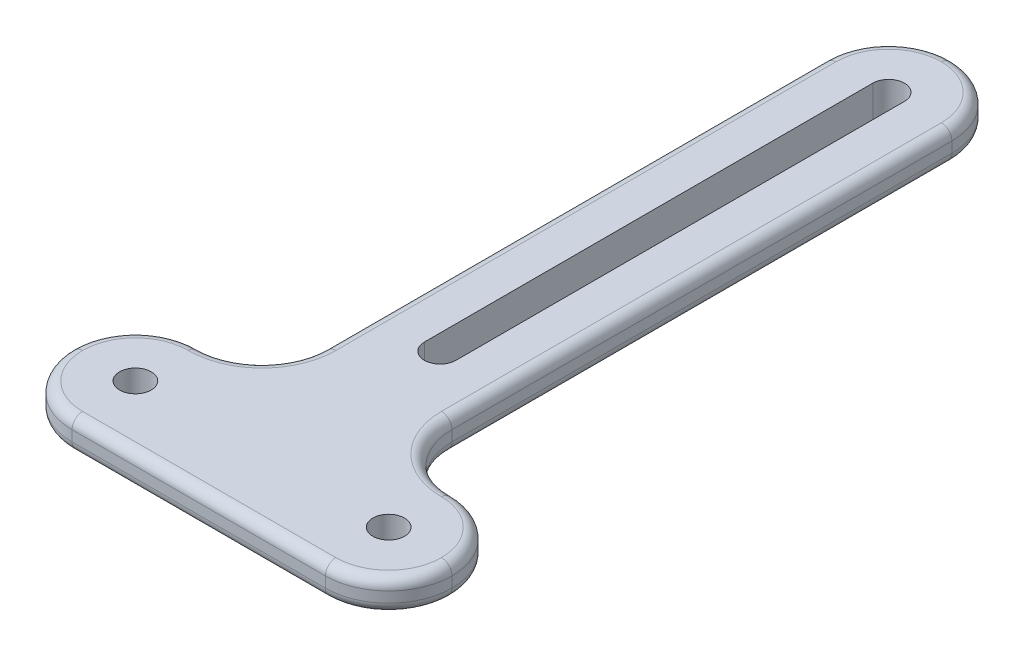
from build123d import *

# Parameters (mm, degrees)
SKETCH1_R           = 3.175
BOSS_EXTRUDE1_DEPTH = 6.35
FILLET2_R           = 12.7
FILLET3_R           = 2.116666667


with BuildPart() as part:
    # Sketch1 → Boss-Extrude1 (new body)
    with BuildSketch(Plane(origin=(0, 0, 0), x_dir=(1, 0, 0), z_dir=(0, 1, 0))):
        Polygon((120.65, 138.369431979), (120.65, 12.7), (95.25, 12.7), (95.25, -12.7), (120.65, -12.7), (146.05, -12.7), (171.45, -12.7), (171.45, 12.7), (146.05, 12.7), (146.05, 138.369431979), align=None)
        with Locations(Location((107.95, 0, 0), (0, 0, 270))):
            Circle(SKETCH1_R, mode=Mode.SUBTRACT)
        with Locations(Location((158.75, 0, 0), (0, 0, 270))):
            Circle(SKETCH1_R, mode=Mode.SUBTRACT)
        with BuildLine():
            Line((130.175, 35.731024811), (130.175, 125.669431979))
            ThreePointArc((130.175, 125.669431979), (133.35, 128.844431979), (136.525, 125.669431979))
            Line((136.525, 125.669431979), (136.525, 35.731024811))
            ThreePointArc((136.525, 35.731024811), (133.35, 32.556024811), (130.175, 35.731024811))
        make_face(mode=Mode.SUBTRACT)
    extrude(amount=BOSS_EXTRUDE1_DEPTH)

    # Fillet2
    fillet2_edges = [part.edges().sort_by_distance(p)[0] for p in [
        (120.65, 3.175, -138.369431979),
        (146.05, 3.175, -138.369431979),
        (146.05, 3.175, -12.7),
        (171.45, 3.175, 12.7),
        (171.45, 3.175, -12.7),
        (95.25, 3.175, 12.7),
        (95.25, 3.175, -12.7),
        (120.65, 3.175, -12.7),
    ]]
    fillet(fillet2_edges, radius=FILLET2_R - 0.0001)  # a hair under: the kernel refuses the full size

    # Fillet3
    fillet3_edges = [part.edges().sort_by_distance(p)[0] for p in [
        (120.65, 0, -75.53471599),
        (120.65, 6.35, -75.53471599),
        (133.35, 0, 12.7),
        (146.05, 0, -75.53471599),
        (98.96971459, 0, -8.98028541),
        (98.96971459, 0, 8.98028541),
        (167.73028541, 0, -8.98028541),
        (167.73028541, 0, 8.98028541),
        (142.33028541, 0, -134.64971739),
        (124.36971459, 0, -134.64971739),
        (146.05, 6.35, -75.53471599),
        (133.35, 6.35, 12.7),
        (98.96971459, 6.35, -8.98028541),
        (98.96971459, 6.35, 8.98028541),
        (167.73028541, 6.35, -8.98028541),
        (167.73028541, 6.35, 8.98028541),
        (142.33028541, 6.35, -134.64971739),
        (124.36971459, 6.35, -134.64971739),
        (149.76971459, 0, -16.41971459),
        (149.76971459, 6.35, -16.41971459),
        (116.93028541, 0, -16.41971459),
        (116.93028541, 6.35, -16.41971459),
    ]]
    fillet(fillet3_edges, radius=FILLET3_R)


solid = part.part
